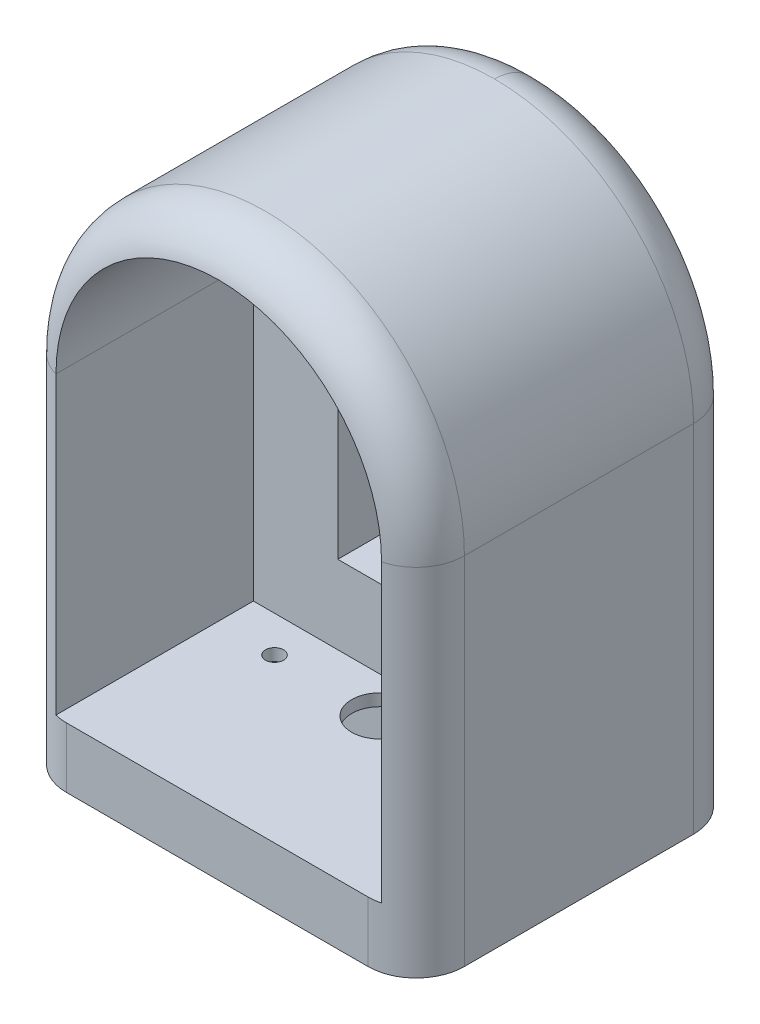
from build123d import *

# Parameters (mm, degrees)
SKETCH1_W           = 33
SKETCH1_H           = 27
BOSS_EXTRUDE1_DEPTH = 46
SKETCH3_W           = 16.5
SKETCH3_H           = 41
CUT_EXTRUDE2_DEPTH  = 59.200085911
FILLET3_R           = 16.5
SKETCH9_W           = 13
SKETCH9_H           = 23
CUT_EXTRUDE4_DEPTH  = 9
SKETCH10_R          = 6.5
CUT_EXTRUDE5_DEPTH  = 56.12259065
SKETCH11_R          = 1
CUT_EXTRUDE6_DEPTH  = 8
BOSS_EXTRUDE7_DEPTH = 16.5
FILLET5_R           = 4
CUT_EXTRUDE7_DEPTH  = 4
SKETCH17_R          = 1.3
CUT_EXTRUDE8_DEPTH  = 1.75
SKETCH18_R          = 2.35
CUT_EXTRUDE9_DEPTH  = 1
SKETCH19_R          = 0.75
CUT_EXTRUDE10_DEPTH = 1.75


# Some blends are built 0.0001 mm under size
with BuildPart() as part:
    # Sketch1 → Boss-Extrude1 (new body)
    with BuildSketch(Plane(origin=(0, 0, 0), x_dir=(1, 0, 0), z_dir=(0, 1, 0))):
        Rectangle(SKETCH1_W, SKETCH1_H)
    extrude(amount=BOSS_EXTRUDE1_DEPTH)

    # Sketch3 → Cut-Extrude2 (cut, through all)
    with BuildSketch(Plane(origin=(16.5, 0, 0), x_dir=(0, 0, -1), z_dir=(1, 0, 0))):
        with Locations((-5.25, 25.5)):
            Rectangle(SKETCH3_W, SKETCH3_H)
    extrude(amount=-CUT_EXTRUDE2_DEPTH, mode=Mode.SUBTRACT)

    # Fillet3
    fillet3_edges = [part.edges().sort_by_distance(p)[0] for p in [
        (-16.5, 46, -8.25),
        (16.5, 46, -8.25),
    ]]
    fillet(fillet3_edges, radius=FILLET3_R - 0.0001)  # a hair under: the kernel refuses the full size

    # Sketch9 → Cut-Extrude4 (cut)
    with BuildSketch(Plane.XY.offset(-3)):
        with Locations((0, 23)):
            Rectangle(SKETCH9_W, SKETCH9_H)
    extrude(amount=-CUT_EXTRUDE4_DEPTH, mode=Mode.SUBTRACT)

    # Sketch10 → Cut-Extrude5 (cut, through all)
    with BuildSketch(Plane.XY.offset(-12)):
        with Locations((0, 28)):
            Circle(SKETCH10_R)
    extrude(amount=-CUT_EXTRUDE5_DEPTH, mode=Mode.SUBTRACT)

    # Sketch11 → Cut-Extrude6 (cut)
    with BuildSketch(Plane.XY.offset(-3)):
        with Locations((0, 36.8)):
            Circle(SKETCH11_R)
        with Locations((0, 9.2)):
            Circle(SKETCH11_R)
    extrude(amount=-CUT_EXTRUDE6_DEPTH, mode=Mode.SUBTRACT)

    # Sketch15 → Boss-Extrude7 (add)
    with BuildSketch(Plane.XY.offset(-3)):
        with BuildLine():
            Line((13.5, 5), (13.5, 29.5))
            ThreePointArc((13.5, 29.5), (9.545941546, 39.045941546), (0, 43))
            ThreePointArc((0, 43), (-9.545941546, 39.045941546), (-13.5, 29.5))
            Line((-13.5, 29.5), (-13.5, 5))
            Line((-13.5, 5), (-16.5, 5))
            Line((-16.5, 5), (-16.5, 29.5))
            ThreePointArc((-16.5, 29.5), (-11.66726189, 41.16726189), (0, 46))
            ThreePointArc((0, 46), (11.66726189, 41.16726189), (16.5, 29.5))
            Line((16.5, 29.5), (16.5, 5))
            Line((16.5, 5), (13.5, 5))
        make_face()
    extrude(amount=BOSS_EXTRUDE7_DEPTH)

    # Fillet5
    # the kernel refuses this fillet: 4 mm, written as the material it takes off along each edge
    with BuildSketch(Plane(origin=(16.5, 29.5, 13.5), x_dir=(0, 0, -1), z_dir=(0, -1, 0))) as fillet5_piece_1:
        with BuildLine():
            CenterArc((FILLET5_R, -FILLET5_R), FILLET5_R, 90, 90)
            Line((0, -FILLET5_R), (0, 0))
            Line((0, 0), (FILLET5_R, 0))
        make_face()
    extrude(amount=39.5, mode=Mode.SUBTRACT)
    with BuildSketch(Plane(origin=(-16.5, 29.5, 13.5), x_dir=(0, 0, -1), z_dir=(0, -1, 0))) as fillet5_piece_2:
        with BuildLine():
            CenterArc((FILLET5_R, FILLET5_R), FILLET5_R, 180, 90)
            Line((0, FILLET5_R), (0, 0))
            Line((0, 0), (FILLET5_R, 0))
        make_face()
    extrude(amount=39.5, mode=Mode.SUBTRACT)
    with BuildSketch(Plane(origin=(-16.5, -10, -13.5), x_dir=(0, 0, 1), z_dir=(0, 1, 0))) as fillet5_piece_3:
        with BuildLine():
            CenterArc((FILLET5_R, FILLET5_R), FILLET5_R, 180, 90)
            Line((0, FILLET5_R), (0, 0))
            Line((0, 0), (FILLET5_R, 0))
        make_face()
    extrude(amount=39.5001, mode=Mode.SUBTRACT)
    with BuildSketch(Plane(origin=(16.5, -10, -13.5), x_dir=(0, 0, 1), z_dir=(0, 1, 0))) as fillet5_piece_4:
        with BuildLine():
            CenterArc((FILLET5_R, -FILLET5_R), FILLET5_R, 90, 90)
            Line((0, -FILLET5_R), (0, 0))
            Line((0, 0), (FILLET5_R, 0))
        make_face()
    extrude(amount=39.5001, mode=Mode.SUBTRACT)
    with BuildSketch(Plane(origin=(0.0001, 29.5001, -13.5), x_dir=(1, 0, 0), z_dir=(0, -1, 0))) as fillet5_piece_5:
        with BuildLine():
            CenterArc((16.4999 - FILLET5_R, FILLET5_R), FILLET5_R, 270, 90)
            Line((16.4999 - FILLET5_R, 0), (16.4999, 0))
            Line((16.4999, 0), (16.4999, FILLET5_R))
        make_face()
    revolve(axis=Axis((0.0001, 29.5001, -13.5), (0, 0, 1)), revolution_arc=90, mode=Mode.SUBTRACT)
    with BuildSketch(Plane(origin=(0, 29.5, 13.5), x_dir=(-1, 0, 0), z_dir=(0, -1, 0))) as fillet5_piece_6:
        with BuildLine():
            CenterArc((16.5 - FILLET5_R, FILLET5_R), FILLET5_R, 270, 90)
            Line((16.5 - FILLET5_R, 0), (16.5, 0))
            Line((16.5, 0), (16.5, FILLET5_R))
        make_face()
    revolve(axis=Axis((0, 29.5, 13.5), (0, 0, -1)), revolution_arc=180, mode=Mode.SUBTRACT)
    with BuildSketch(Plane(origin=(0.0001, 46, -13.5), x_dir=(0, 0, 1), z_dir=(-1, 0, 0))) as fillet5_piece_7:
        with BuildLine():
            CenterArc((FILLET5_R, -FILLET5_R), FILLET5_R, 90, 90)
            Line((0, -FILLET5_R), (0, 0))
            Line((0, 0), (FILLET5_R, 0))
        make_face()
    extrude(amount=0.0002, mode=Mode.SUBTRACT)
    with BuildSketch(Plane(origin=(-0.0001, 29.5001, -13.5), x_dir=(-1, 0, 0), z_dir=(0, -1, 0))) as fillet5_piece_8:
        with BuildLine():
            CenterArc((16.4999 - FILLET5_R, -FILLET5_R), FILLET5_R, 0, 90)
            Line((16.4999 - FILLET5_R, 0), (16.4999, 0))
            Line((16.4999, 0), (16.4999, -FILLET5_R))
        make_face()
    revolve(axis=Axis((-0.0001, 29.5001, -13.5), (0, 0, -1)), revolution_arc=90, mode=Mode.SUBTRACT)

    # Sketch4 → Cut-Extrude7 (cut)
    with BuildSketch(Plane.XZ):
        with BuildLine():
            Line((0.133928571, 2.49641005), (14.09375, 1.747487035))
            ThreePointArc((14.09375, 1.747487035), (15.75, 0), (14.09375, -1.747487035))
            Line((14.09375, -1.747487035), (0.133928571, -2.49641005))
            ThreePointArc((0.133928571, -2.49641005), (0, -2.5), (-0.133928571, -2.49641005))
            Line((-0.133928571, -2.49641005), (-14.09375, -1.747487035))
            ThreePointArc((-14.09375, -1.747487035), (-15.75, 0), (-14.09375, 1.747487035))
            Line((-14.09375, 1.747487035), (-0.133928571, 2.49641005))
            ThreePointArc((-0.133928571, 2.49641005), (0, 2.5), (0.133928571, 2.49641005))
        make_face()
    extrude(amount=-CUT_EXTRUDE7_DEPTH, mode=Mode.SUBTRACT)

    # Sketch17 → Cut-Extrude8 (cut)
    with BuildSketch(Plane.XZ.offset(-4)):
        with Locations(Location((0, 0, 0), (0, 0, 270))):
            Circle(SKETCH17_R)
    extrude(amount=-CUT_EXTRUDE8_DEPTH, mode=Mode.SUBTRACT)

    # Sketch18 → Cut-Extrude9 (cut)
    with BuildSketch(Plane(origin=(0, 5, 0), x_dir=(1, 0, 0), z_dir=(0, 1, 0))):
        with Locations(Location((0, 0, 0), (0, 0, 270))):
            Circle(SKETCH18_R)
    extrude(amount=-CUT_EXTRUDE9_DEPTH, mode=Mode.SUBTRACT)

    # Sketch19 → Cut-Extrude10 (cut)
    with BuildSketch(Plane.XZ.offset(-4)):
        with Locations(Location((-8.75, 0, 0), (0, 0, 270))):
            Circle(SKETCH19_R)
        with Locations(Location((8.75, 0, 0), (0, 0, 270))):
            Circle(SKETCH19_R)
    extrude(amount=-CUT_EXTRUDE10_DEPTH, mode=Mode.SUBTRACT)


solid = part.part
